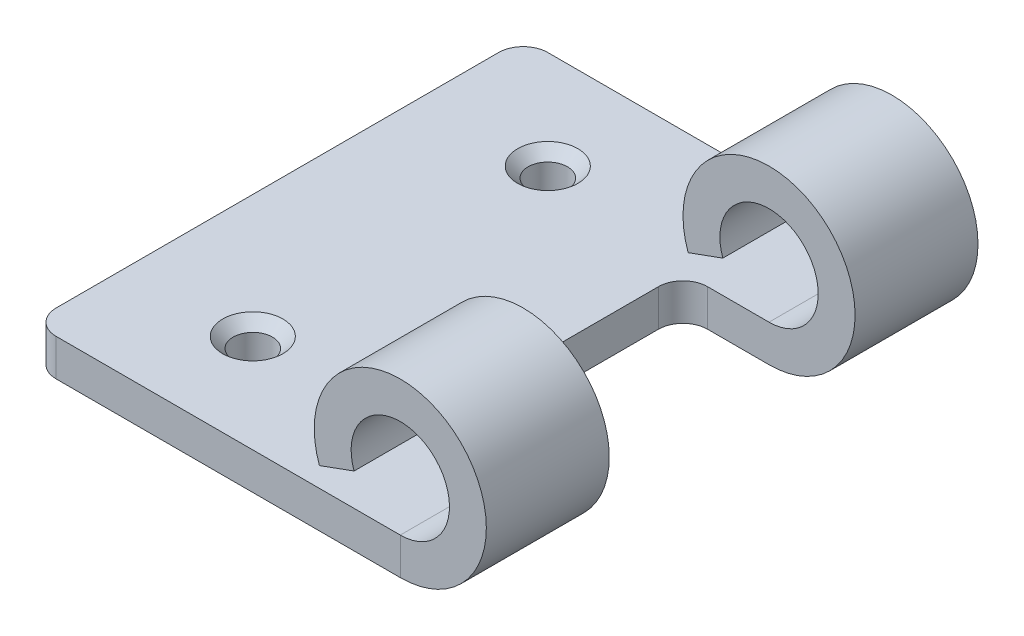
from build123d import *

# Parameters (mm, degrees)
BASE_FLANGE1_DEPTH              = 10
CUT_EXTRUDE1_DEPTH              = 22.737065119
CUT_EXTRUDE1_DEPTH_BACK         = 22.737065119
SKETCH6_W                       = 7
SKETCH6_H                       = 10
FILLET1_R                       = 1
M2X0_4_TAPPED_HOLE1_D           = 1.6
M2X0_4_TAPPED_HOLE1_CSINK_D     = 2.45
M2X0_4_TAPPED_HOLE1_CSINK_ANGLE = 90


# Sheet-metal steps are written as plain solids
with BuildPart() as part:
    # Sketch1 → Base-Flange1 (new, symmetric)
    with BuildSketch(Plane.XY):
        with BuildLine():
            Line((0, 0), (15, 0))
            ThreePointArc((15, 0), (16.147152873, 3.638304089), (13.120614758, 1.315959713))
            Line((13.120614758, 1.315959713), (11.711075827, 0.802929498))
            ThreePointArc((11.711075827, 0.802929498), (17.007517527, 4.867032155), (15, -1.5))
            Line((15, -1.5), (0, -1.5))
            Line((0, -1.5), (0, 0))
        make_face()
    extrude(amount=BASE_FLANGE1_DEPTH, both=True)

    # Sketch6 → Cut-Extrude1 (cut, two sides: drawn at the far end of the back side and taken through both)
    with BuildSketch(Plane(origin=(0, 0, 0), x_dir=(1, 0, 0), z_dir=(0, 1, 0)).offset(-CUT_EXTRUDE1_DEPTH_BACK)):
        with Locations((15, 0)):
            Rectangle(SKETCH6_W, SKETCH6_H)
    extrude(amount=CUT_EXTRUDE1_DEPTH + CUT_EXTRUDE1_DEPTH_BACK, mode=Mode.SUBTRACT)

    # Fillet1
    fillet1_edges = [part.edges().sort_by_distance(p)[0] for p in [
        (0, -0.75, 10),
        (11.5, -0.75, -5),
        (11.5, -0.75, 5),
        (0, -0.75, -10),
    ]]
    fillet(fillet1_edges, radius=FILLET1_R)

    # M2x0.4 Tapped Hole1 (through all)
    with Locations(Plane(origin=(0, 0, 0), x_dir=(1, 0, 0), z_dir=(0, 1, 0))):
        with Locations((5, 6), (5, -6)):
            CounterSinkHole(M2X0_4_TAPPED_HOLE1_D / 2, M2X0_4_TAPPED_HOLE1_CSINK_D / 2, counter_sink_angle=M2X0_4_TAPPED_HOLE1_CSINK_ANGLE)


solid = part.part
